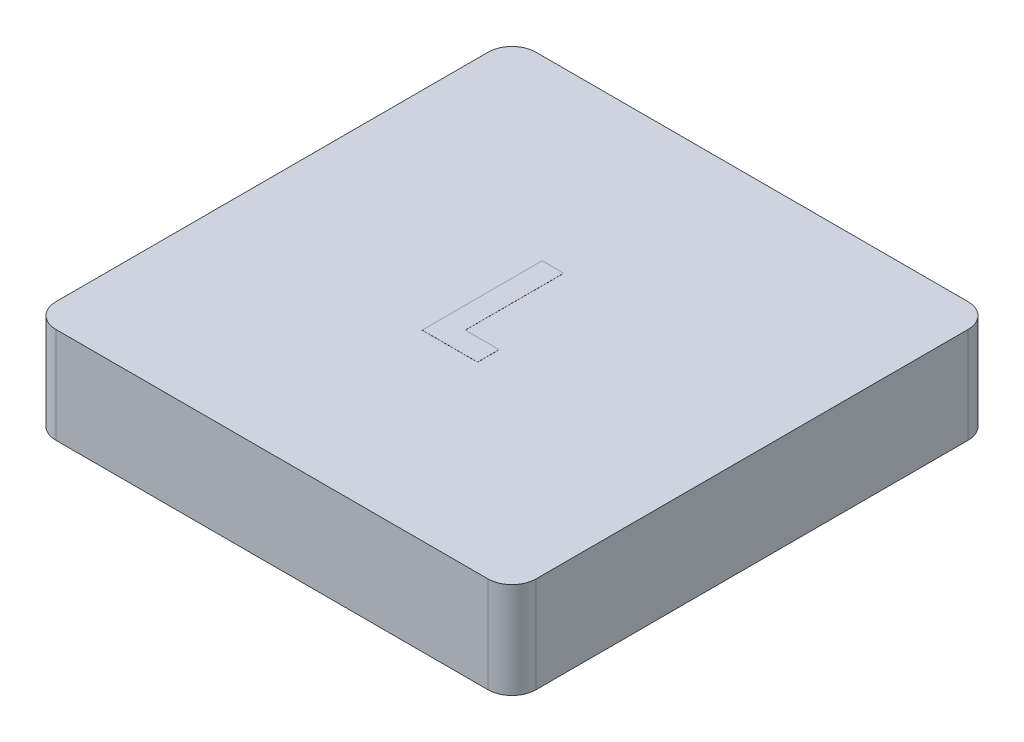
from build123d import *

# Parameters (mm, degrees)
SKETCH1_W           = 12.7
SKETCH1_H           = 12.7
BOSS_EXTRUDE1_DEPTH = 2.54
FILLET1_R           = 0.635
SHELL1_START        = 0.635
SHELL1_OUTLINE_W    = 1.905
SHELL1_OUTLINE_H    = 11.43
SHELL1_DEPTH        = 11.43
SKETCH2_R           = 2.54
BOSS_EXTRUDE2_DEPTH = 1.905
BOSS_EXTRUDE3_DEPTH = 0.00254


# Read off the part's stored shape, not the designer's step: Shell1
with BuildPart() as part:
    # Sketch1 → Boss-Extrude1 (new body)
    with BuildSketch(Plane(origin=(0, 0, 0), x_dir=(1, 0, 0), z_dir=(0, 1, 0))):
        with Locations((6.35, 6.35)):
            Rectangle(SKETCH1_W, SKETCH1_H)
    extrude(amount=BOSS_EXTRUDE1_DEPTH)

    # Fillet1
    fillet1_edges = [part.edges().sort_by_distance(p)[0] for p in [
        (0, 1.27, -12.7),
        (12.7, 1.27, -12.7),
        (12.7, 1.27, 0),
        (0, 1.27, 0),
    ]]
    fillet(fillet1_edges, radius=FILLET1_R)

    # Shell1 outline → Shell1 (cut)
    with BuildSketch(Plane.YZ.offset(SHELL1_START)):
        with Locations((0.9525, -6.35)):
            Rectangle(SHELL1_OUTLINE_W, SHELL1_OUTLINE_H)
    extrude(amount=SHELL1_DEPTH, mode=Mode.SUBTRACT)

    # Sketch2 → Boss-Extrude2 (add)
    with BuildSketch(Plane(origin=(0, 1.905, 0), x_dir=(-1, 0, 0), z_dir=(0, -1, 0))):
        with Locations(Location((-6.35, 6.35, 0), (0, 0, 270))):
            Circle(SKETCH2_R)
    extrude(amount=BOSS_EXTRUDE2_DEPTH)

    # Sketch3 → Boss-Extrude3 (add)
    with BuildSketch(Plane(origin=(0, 2.54, 0), x_dir=(1, 0, 0), z_dir=(0, 1, 0))):
        Polygon((5.497146154, 8.001), (6.067017949, 8.001), (6.067017949, 5.395871795), (6.962530769, 5.395871795), (6.962530769, 4.826), (5.497146154, 4.826), align=None)
    extrude(amount=BOSS_EXTRUDE3_DEPTH)


solid = part.part
